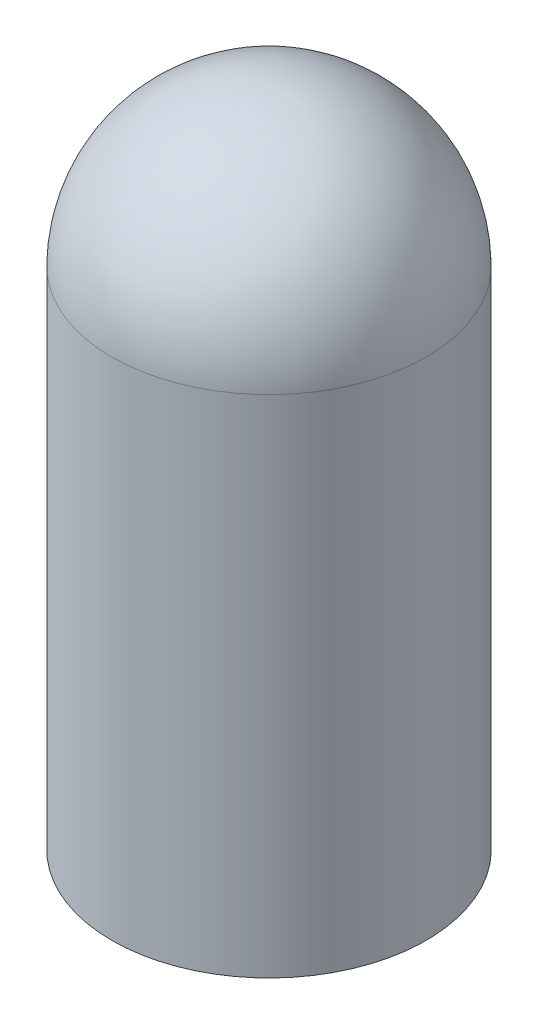
from build123d import *

# Parameters (mm, degrees)
SKETCH1_R           = 51.3588
BOSS_EXTRUDE1_DEPTH = 165.1
DOME1_FACE_RADIUS   = 51.3588
DOME1_HEIGHT        = 50.8


# Read off the part's stored shape, not the designer's step: Shell1
with BuildPart() as part:
    # Sketch1 → Boss-Extrude1 (new body)
    with BuildSketch(Plane(origin=(0, 0, 0), x_dir=(1, 0, 0), z_dir=(0, 1, 0))):
        with Locations(Location((0, 0, 0), (0, 0, 270))):
            Circle(SKETCH1_R)
    extrude(amount=BOSS_EXTRUDE1_DEPTH)

    # Dome1: a dome of height H over a round flat face of radius A is a cap of a sphere of radius (A * A + H * H) / (2 * H)
    dome1_r = (DOME1_FACE_RADIUS * DOME1_FACE_RADIUS + DOME1_HEIGHT * DOME1_HEIGHT) / (2 * DOME1_HEIGHT)
    dome1_base = Plane((0, 165.1, 0), z_dir=(0, 1, 0))
    with Locations(dome1_base.offset(DOME1_HEIGHT - dome1_r)):
        dome1_ball = Sphere(dome1_r, mode=Mode.PRIVATE)
    add(split(dome1_ball, bisect_by=dome1_base, keep=Keep.TOP, mode=Mode.PRIVATE))

    # Shell1 outline → Shell1 (revolve, cut)
    with BuildSketch(Plane.XY):
        with BuildLine():
            Line((50.8, 0), (50.800000001, 165.096935001))
            ThreePointArc((50.800000001, 165.096935001), (35.725082804, 200.65835259), (0, 215.3412))
            Line((0, 215.3412), (0, 0))
            Line((0, 0), (50.8, 0))
        make_face()
    revolve(axis=Axis((0, 0, 0), (0, 1, 0)), mode=Mode.SUBTRACT)


solid = part.part
